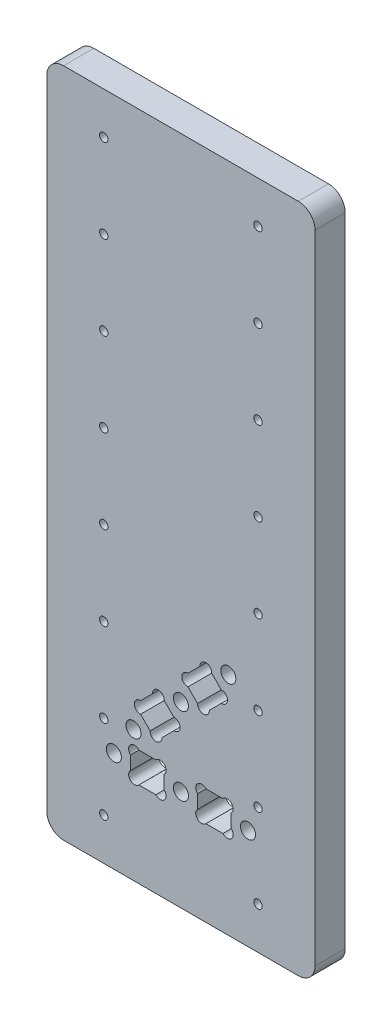
from build123d import *

# Parameters (mm, degrees)
ESQUISSE1_W                  = 80
ESQUISSE1_H                  = 200
BOSS_EXTRU_1_DEPTH           = 9
ENL_V_MAT_EXTRU_1_DEPTH      = 216.594526832
ENL_V_MAT_EXTRU_1_DEPTH_BACK = 216.594526832
ESQUISSE2_R                  = 1.25
ENL_V_MAT_EXTRU_2_DEPTH      = 216.594526832
ENL_V_MAT_EXTRU_2_DEPTH_BACK = 216.594526832
CONG_1_R                     = 5
ENL_V_MAT_EXTRU_3_DEPTH      = 216.594526832
ENL_V_MAT_EXTRU_3_DEPTH_BACK = 216.594526832
ESQUISSE4_R                  = 2.25
ENL_V_MAT_EXTRU_4_DEPTH      = 216.594526832
ENL_V_MAT_EXTRU_4_DEPTH_BACK = 216.594526832
ESQUISSE5_R                  = 2.25


with BuildPart() as part:
    # Esquisse1 → Boss.-Extru.1 (new body)
    with BuildSketch(Plane.XY):
        with Locations((40, 100)):
            Rectangle(ESQUISSE1_W, ESQUISSE1_H)
    extrude(amount=BOSS_EXTRU_1_DEPTH)

    # Esquisse2 → Enlèv. mat.-Extru.1 (cut, two sides: drawn at the far end of the back side and taken through both)
    with BuildSketch(Plane.XY.offset(9).offset(-ENL_V_MAT_EXTRU_1_DEPTH_BACK)):
        with Locations((17, 187.5)):
            Circle(ESQUISSE2_R)
        with Locations((17, 87.5)):
            Circle(ESQUISSE2_R)
        with Locations((17, 62.5)):
            Circle(ESQUISSE2_R)
        with Locations((17, 37.5)):
            Circle(ESQUISSE2_R)
        with Locations((17, 12.5)):
            Circle(ESQUISSE2_R)
        with Locations((17, 162.5)):
            Circle(ESQUISSE2_R)
        with Locations((17, 137.5)):
            Circle(ESQUISSE2_R)
        with Locations((17, 112.5)):
            Circle(ESQUISSE2_R)
        with Locations((63, 112.5)):
            Circle(ESQUISSE2_R)
        with Locations((63, 137.5)):
            Circle(ESQUISSE2_R)
        with Locations((63, 162.5)):
            Circle(ESQUISSE2_R)
        with Locations((63, 12.5)):
            Circle(ESQUISSE2_R)
        with Locations((63, 37.5)):
            Circle(ESQUISSE2_R)
        with Locations((63, 62.5)):
            Circle(ESQUISSE2_R)
        with Locations((63, 87.5)):
            Circle(ESQUISSE2_R)
        with Locations((63, 187.5)):
            Circle(ESQUISSE2_R)
    extrude(amount=ENL_V_MAT_EXTRU_1_DEPTH + ENL_V_MAT_EXTRU_1_DEPTH_BACK, mode=Mode.SUBTRACT)

    # Esquisse3 → Enlèv. mat.-Extru.2 (cut, two sides: drawn at the far end of the back side and taken through both)
    with BuildSketch(Plane.XY.offset(9).offset(-ENL_V_MAT_EXTRU_2_DEPTH_BACK)):
        Polygon((46.717514421, 53.535533906), (53.788582233, 60.606601718), (47.424621202, 66.970562748), (40.353553391, 59.899494937), align=None)
        Polygon((33.282485579, 52.828427125), (39.646446609, 46.464466094), (32.575378798, 39.393398282), (26.211417767, 45.757359313), align=None)
    extrude(amount=ENL_V_MAT_EXTRU_2_DEPTH + ENL_V_MAT_EXTRU_2_DEPTH_BACK, mode=Mode.SUBTRACT)

    # Congé1
    cong_1_edges = [part.edges().sort_by_distance(p)[0] for p in [
        (0, 200, 4.5),
        (80, 200, 4.5),
        (80, 0, 4.5),
        (0, 0, 4.5),
    ]]
    fillet(cong_1_edges, radius=CONG_1_R)

    # Esquisse4 → Enlèv. mat.-Extru.3 (cut, two sides: drawn at the far end of the back side and taken through both)
    with BuildSketch(Plane.XY.offset(9).offset(-ENL_V_MAT_EXTRU_3_DEPTH_BACK)):
        with Locations((40, 53.181980515)):
            Circle(ESQUISSE4_R)
        with Locations((25.857864376, 39.039844892)):
            Circle(ESQUISSE4_R)
        with Locations((54.142135624, 67.324116139)):
            Circle(ESQUISSE4_R)
        with BuildLine():
            Line((27.961417767, 47.507359313), (27.961417767, 44.007359313))
            ThreePointArc((27.961417767, 44.007359313), (26.111417767, 45.757359313), (27.961417767, 47.507359313))
        make_face()
        with BuildLine():
            Line((31.532485579, 51.078427125), (35.032485579, 51.078427125))
            ThreePointArc((35.032485579, 51.078427125), (33.282485579, 52.928427125), (31.532485579, 51.078427125))
        make_face()
        with BuildLine():
            Line((37.896446609, 44.714466094), (37.896446609, 48.214466094))
            ThreePointArc((37.896446609, 48.214466094), (39.746446609, 46.464466094), (37.896446609, 44.714466094))
        make_face()
        with BuildLine():
            Line((34.325378798, 41.143398282), (30.825378798, 41.143398282))
            ThreePointArc((30.825378798, 41.143398282), (32.575378798, 39.293398282), (34.325378798, 41.143398282))
        make_face()
        with BuildLine():
            Line((52.038582233, 58.856601718), (52.038582233, 62.356601718))
            ThreePointArc((52.038582233, 62.356601718), (53.888582233, 60.606601718), (52.038582233, 58.856601718))
        make_face()
        with BuildLine():
            Line((48.467514421, 55.285533906), (44.967514421, 55.285533906))
            ThreePointArc((44.967514421, 55.285533906), (46.717514421, 53.435533906), (48.467514421, 55.285533906))
        make_face()
        with BuildLine():
            Line((42.103553391, 61.649494937), (42.103553391, 58.149494937))
            ThreePointArc((42.103553391, 58.149494937), (40.253553391, 59.899494937), (42.103553391, 61.649494937))
        make_face()
        with BuildLine():
            Line((45.674621202, 65.220562748), (49.174621202, 65.220562748))
            ThreePointArc((49.174621202, 65.220562748), (47.424621202, 67.070562748), (45.674621202, 65.220562748))
        make_face()
    extrude(amount=ENL_V_MAT_EXTRU_3_DEPTH + ENL_V_MAT_EXTRU_3_DEPTH_BACK, mode=Mode.SUBTRACT)

    # Esquisse5 → Enlèv. mat.-Extru.4 (cut, two sides: drawn at the far end of the back side and taken through both)
    with BuildSketch(Plane.XY.offset(9).offset(-ENL_V_MAT_EXTRU_4_DEPTH_BACK)):
        with Locations((60, 30)):
            Circle(ESQUISSE5_R)
        with Locations((40, 30)):
            Circle(ESQUISSE5_R)
        with Locations((20, 30)):
            Circle(ESQUISSE5_R)
        with BuildLine():
            Line((52.525126266, 25.5), (47.474873734, 25.5))
            ThreePointArc((47.474873734, 25.5), (44.929289322, 25.429289322), (45, 27.974873734))
            Line((45, 27.974873734), (45, 32.025126266))
            ThreePointArc((45, 32.025126266), (44.929289322, 34.570710678), (47.474873734, 34.5))
            Line((47.474873734, 34.5), (52.525126266, 34.5))
            ThreePointArc((52.525126266, 34.5), (55.070710678, 34.570710678), (55, 32.025126266))
            Line((55, 32.025126266), (55, 27.974873734))
            ThreePointArc((55, 27.974873734), (55.070710678, 25.429289322), (52.525126266, 25.5))
        make_face()
        with BuildLine():
            Line((32.525126266, 25.5), (27.474873734, 25.5))
            ThreePointArc((27.474873734, 25.5), (24.929289322, 25.429289322), (25, 27.974873734))
            Line((25, 27.974873734), (25, 32.025126266))
            ThreePointArc((25, 32.025126266), (24.929289322, 34.570710678), (27.474873734, 34.5))
            Line((27.474873734, 34.5), (32.525126266, 34.5))
            ThreePointArc((32.525126266, 34.5), (35.070710678, 34.570710678), (35, 32.025126266))
            Line((35, 32.025126266), (35, 27.974873734))
            ThreePointArc((35, 27.974873734), (35.070710678, 25.429289322), (32.525126266, 25.5))
        make_face()
    extrude(amount=ENL_V_MAT_EXTRU_4_DEPTH + ENL_V_MAT_EXTRU_4_DEPTH_BACK, mode=Mode.SUBTRACT)


solid = part.part
